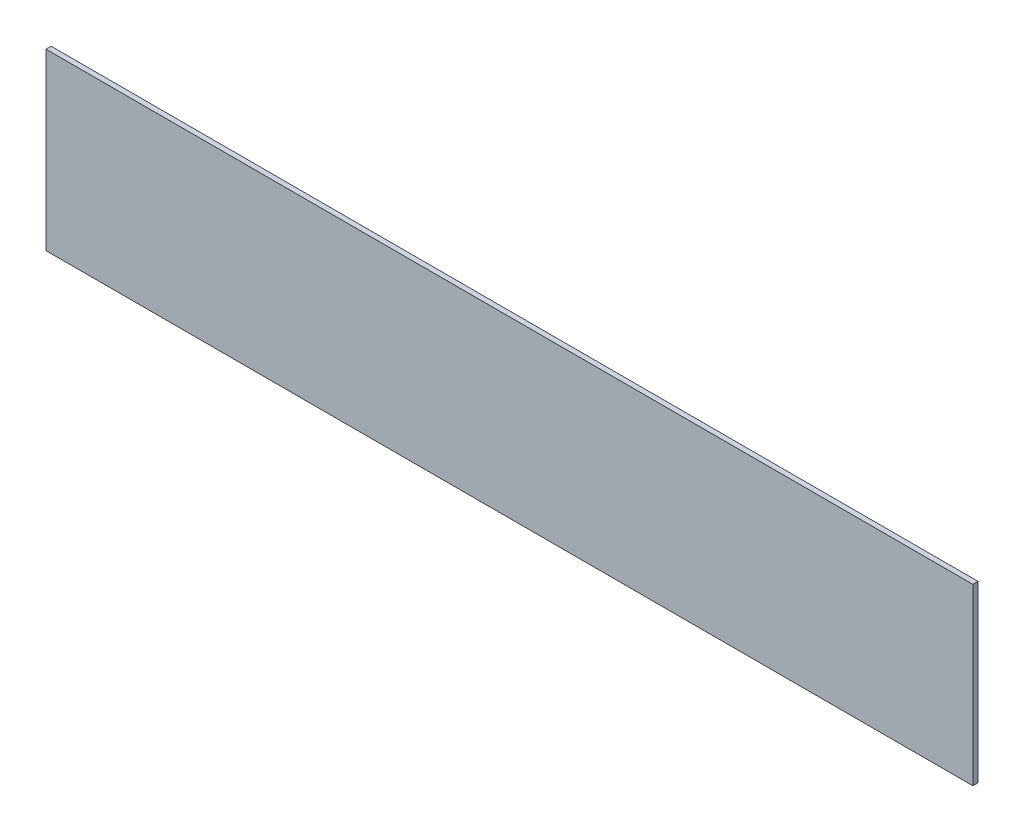
from build123d import *

# Parameters (mm, degrees)
SKETCH1_W           = 228.727
SKETCH1_H           = 43.053
BOSS_EXTRUDE1_DEPTH = 1.27


with BuildPart() as part:
    # Sketch1 → Boss-Extrude1 (new body)
    with BuildSketch(Plane.XY):
        with Locations((67.750915375, -5.09294171)):
            Rectangle(SKETCH1_W, SKETCH1_H)
    extrude(amount=BOSS_EXTRUDE1_DEPTH)


solid = part.part
